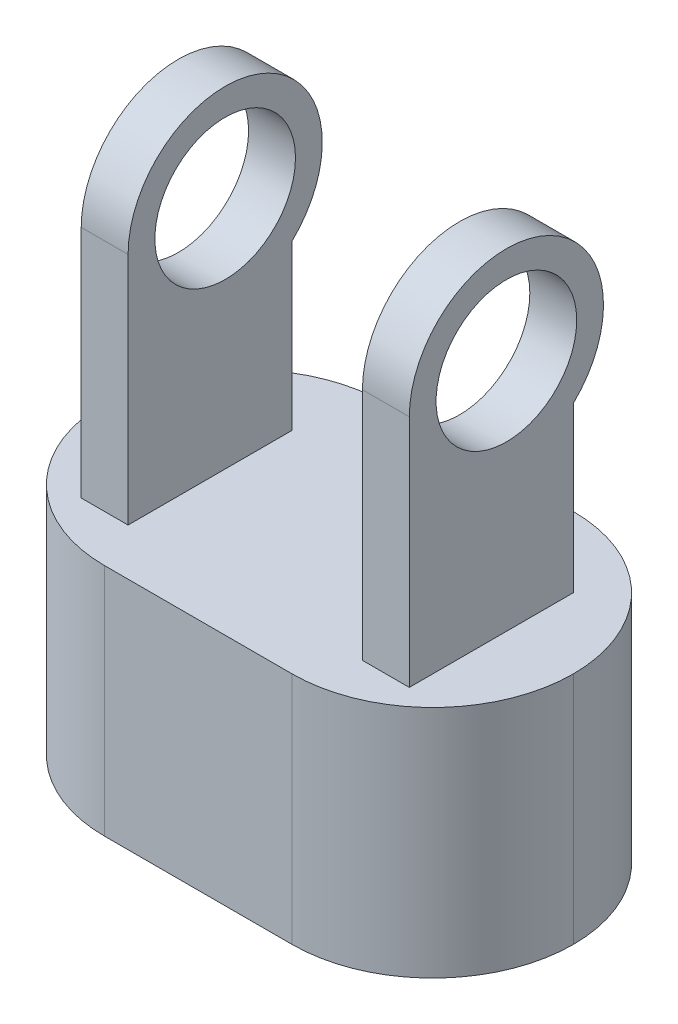
from build123d import *

# Parameters (mm, degrees)
SKETCH1_W           = 20
SKETCH1_H           = 12
BOSS_EXTRUDE1_DEPTH = 10
SKETCH4_R           = 3
BOSS_EXTRUDE2_DEPTH = 1
FILLET1_R           = 6


with BuildPart() as part:
    # Sketch1 → Boss-Extrude1 (new body)
    with BuildSketch(Plane(origin=(0, 0, 0), x_dir=(1, 0, 0), z_dir=(0, 1, 0))):
        with Locations((0, 6)):
            Rectangle(SKETCH1_W, SKETCH1_H)
    extrude(amount=BOSS_EXTRUDE1_DEPTH)

    # Sketch4 → Boss-Extrude2 (add, symmetric)
    with BuildSketch(Plane(origin=(-6, 0, 0), x_dir=(0, 0, -1), z_dir=(1, 0, 0))):
        with BuildLine():
            Line((2, 10), (2, 20))
            ThreePointArc((2, 20), (7.774808523, 23.807886553), (9, 17))
            Line((9, 17), (9, 10))
            Line((9, 10), (2, 10))
        make_face()
        with Locations((6.142857143, 20)):
            Circle(SKETCH4_R, mode=Mode.SUBTRACT)
    boss_extrude2 = extrude(amount=BOSS_EXTRUDE2_DEPTH, both=True)

    # Mirror1: Boss-Extrude2 across plane
    add(boss_extrude2.mirror(Plane(origin=(0, 0, 0), x_dir=(0, 0, 1), z_dir=(1, 0, 0))))

    # Fillet1
    fillet1_edges = [part.edges().sort_by_distance(p)[0] for p in [
        (-10, 5, -12),
        (10, 5, -12),
        (10, 5, 0),
        (-10, 5, 0),
    ]]
    fillet(fillet1_edges, radius=FILLET1_R - 0.0001)  # a hair under: the kernel refuses the full size


solid = part.part
